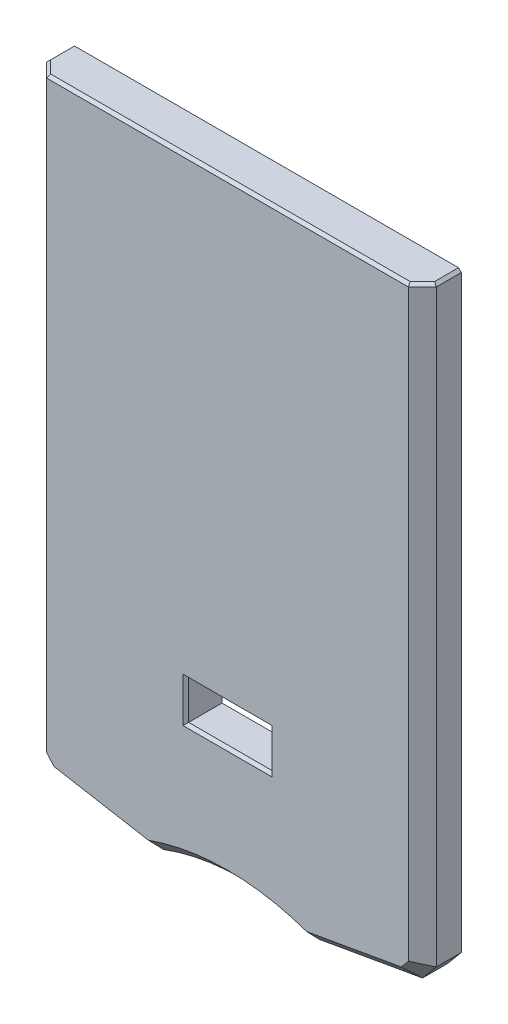
from build123d import *

# Parameters (mm, degrees)
SKETCH1_W            = 15
SKETCH1_H            = 7
BOSS_EXTRUDE1_DEPTH  = 7
F_2_5MM_CHAMFER_SIZE = 2.5
F_0_5MM_CHAMFER_SIZE = 0.5


with BuildPart() as part:
    # Sketch1 → Boss-Extrude1 (new body)
    with BuildSketch(Plane.XY):
        with BuildLine():
            Line((-32.537980617, 40.737323881), (-14.002564118, 37.469029853))
            ThreePointArc((-14.002564118, 37.469029853), (0, 40), (14.002564118, 37.469029853))
            Line((14.002564118, 37.469029853), (32.537980617, 40.737323881))
            Line((32.537980617, 40.737323881), (35, 43.671444325))
            Line((35, 43.671444325), (35, 150))
            Line((35, 150), (-35, 150))
            Line((-35, 150), (-35, 43.671444325))
            Line((-35, 43.671444325), (-32.537980617, 40.737323881))
        make_face()
        with Locations((0, 65)):
            Rectangle(SKETCH1_W, SKETCH1_H, mode=Mode.SUBTRACT)
    extrude(amount=BOSS_EXTRUDE1_DEPTH)

    # 2,5mm Chamfer
    f_2_5mm_chamfer_edges = [part.edges().sort_by_distance(p)[0] for p in [
        (-35, 96.835722162, 7),
        (-23.270272368, 39.103176867, 7),
        (0, 40, 7),
        (23.270272368, 39.103176867, 7),
        (35, 96.835722162, 7),
        (-33.768990309, 42.204384103, 7),
        (33.768990309, 42.204384103, 7),
    ]]
    chamfer(f_2_5mm_chamfer_edges, length=F_2_5MM_CHAMFER_SIZE)

    # 0,5mm Chamfer
    f_0_5mm_chamfer_edges = [part.edges().sort_by_distance(p)[0] for p in [
        (35, 150, 2.25),
        (33.75, 150, 5.75),
        (0, 150, 7),
        (-33.75, 150, 5.75),
        (-35, 150, 2.25),
        (0, 61.5, 7),
        (7.5, 65, 7),
        (0, 68.5, 7),
        (-7.5, 65, 7),
        (0, 61.5, 0),
        (-7.5, 65, 0),
        (0, 68.5, 0),
        (7.5, 65, 0),
    ]]
    chamfer(f_0_5mm_chamfer_edges, length=F_0_5MM_CHAMFER_SIZE)


solid = part.part
